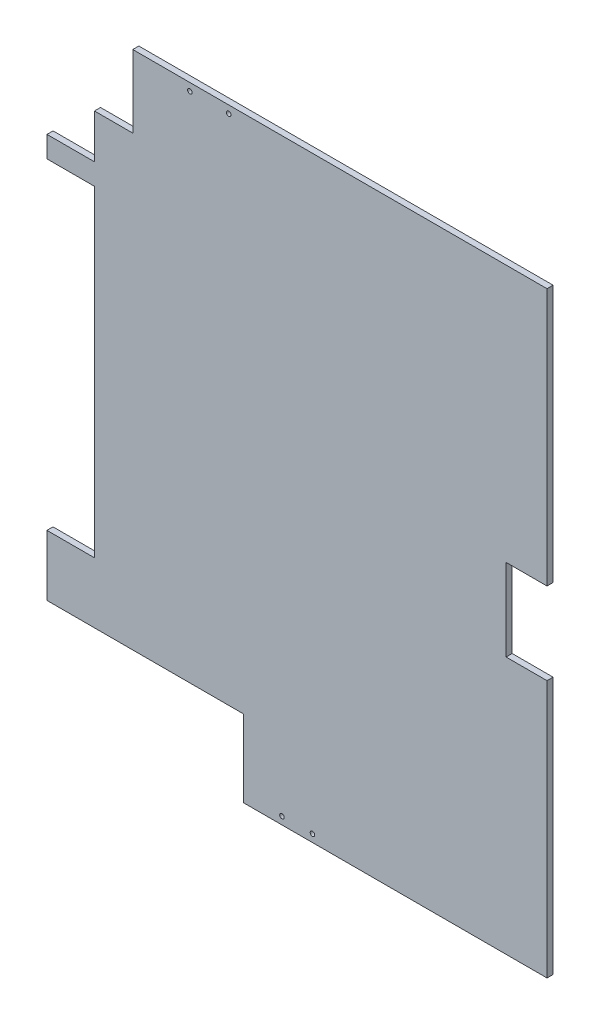
from build123d import *

# Parameters (mm, degrees)
BOSS_EXTRUDE1_DEPTH     = 4
SKETCH2_R               = 1.5
CUT_EXTRUDE1_DEPTH      = 453.211602922
CUT_EXTRUDE2_DEPTH      = 455.953272433
CUT_EXTRUDE2_DEPTH_BACK = 455.953272433
SKETCH3_W               = 24.5
SKETCH3_H               = 54
SKETCH4_W               = 26.984189883
SKETCH4_H               = 54
CUT_EXTRUDE3_DEPTH      = 10


with BuildPart() as part:
    # Sketch1 → Boss-Extrude1 (new body)
    with BuildSketch(Plane.XY):
        Polygon((-5.782297403, 1), (-5.782297403, -13), (25.5, -13), (25.5, -225), (-5.82455923, -225), (-5.82455923, -265), (123.748117859, -265), (123.748117859, -315.7), (323.748117859, -315.7), (323.748117859, 77.7), (50.748117859, 77.7), (50.748117859, 30), (25.5, 30), (25.5, 1), align=None)
    extrude(amount=BOSS_EXTRUDE1_DEPTH)

    # Sketch2 → Cut-Extrude1 (cut, through all)
    with BuildSketch(Plane(origin=(0, 0, 0), x_dir=(-1, 0, 0), z_dir=(0, 0, -1))):
        with Locations((-113.998383462, 72.7)):
            Circle(SKETCH2_R)
        with Locations((-88.397045893, 72.7)):
            Circle(SKETCH2_R)
        with Locations((-169.168895948, -310.7)):
            Circle(SKETCH2_R)
        with Locations((-149.084447974, -310.7)):
            Circle(SKETCH2_R)
    extrude(amount=-CUT_EXTRUDE1_DEPTH, mode=Mode.SUBTRACT)

    # Sketch3 → Cut-Extrude2 (cut, two sides: drawn at the far end of the back side and taken through both)
    with BuildSketch(Plane(origin=(119.391473557, 0, 256.035841294), x_dir=(0.9063077870366519, 0, -0.42261826174069517), z_dir=(0.42261826174069517, 0, 0.9063077870366519)).offset(-CUT_EXTRUDE2_DEPTH_BACK)):
        with Locations((281.209458836, -119)):
            Rectangle(SKETCH3_W, SKETCH3_H)
    extrude(amount=CUT_EXTRUDE2_DEPTH + CUT_EXTRUDE2_DEPTH_BACK, mode=Mode.SUBTRACT)

    # Sketch4 → Cut-Extrude3 (cut)
    with BuildSketch(Plane(origin=(0, 0, 0), x_dir=(-1, 0, 0), z_dir=(0, 0, -1))):
        with Locations((-310.256022917, -119)):
            Rectangle(SKETCH4_W, SKETCH4_H)
    extrude(amount=-CUT_EXTRUDE3_DEPTH, mode=Mode.SUBTRACT)


solid = part.part
